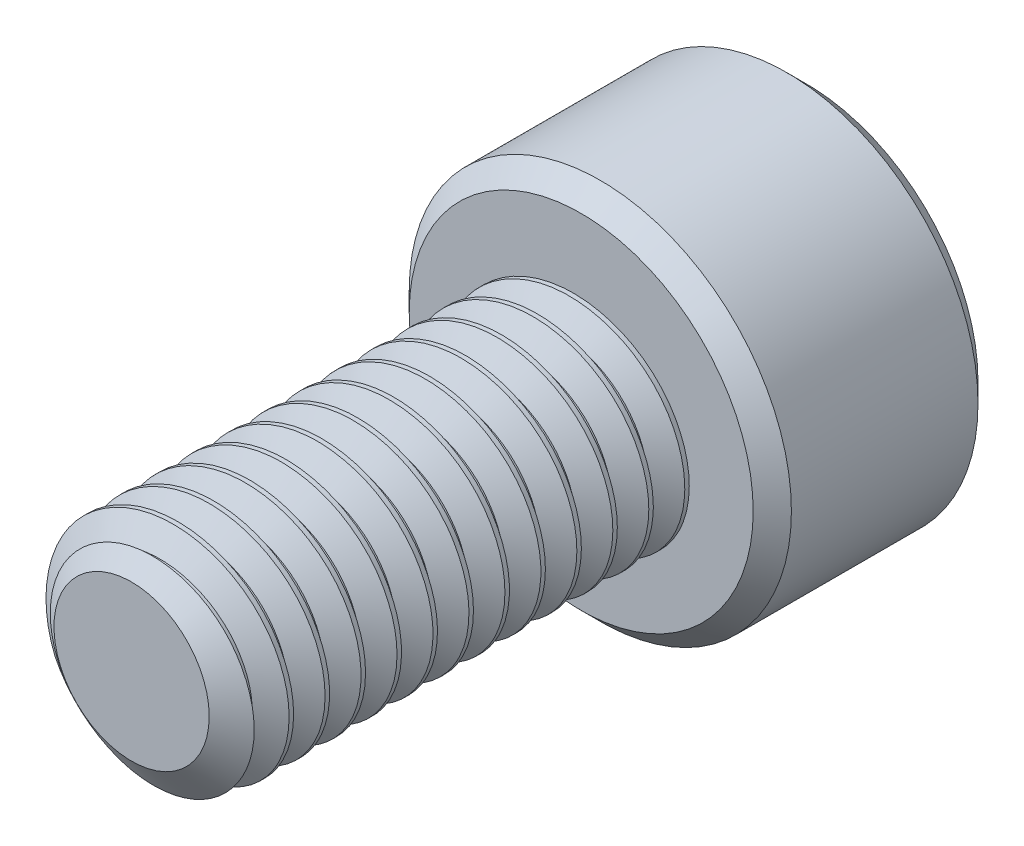
from build123d import *

# Parameters (mm, degrees)
SKETCH1_R          = 2.5
EXTRUDE1_DEPTH     = 10
CUT_SWEEP1_PITCH   = 0.8
SKETCH6_R          = 4.25
EXTRUDE2_DEPTH     = 5
CUT_EXTRUDE1_DEPTH = 3
CHAMFER1_SIZE      = 0.425


with BuildPart() as part:
    # Sketch1 → Extrude1 (new body)
    with BuildSketch(Plane.XY):
        Circle(SKETCH1_R)
    extrude(amount=-EXTRUDE1_DEPTH)

    # Cut-Sweep1: the profile of Sketch3 profile screwed along a right-hand helix of 13.5 turns, 6 arcs to a turn; built about Z, then put on its axis
    cut_sweep1_z = Axis((0, 0, 0), (0, 0, 1))
    cut_sweep1_corners = [(2.5003, 0, -0.700173205), (1.980384758, 0, -0.4), (1.980384758, 0, -0.3), (2.5003, 0, 0.000173205)]
    with BuildLine(mode=Mode.PRIVATE) as cut_sweep1_profile:
        Line(cut_sweep1_corners[0], cut_sweep1_corners[1])
        Line(cut_sweep1_corners[1], cut_sweep1_corners[2])
        Line(cut_sweep1_corners[2], cut_sweep1_corners[3])
        Line(cut_sweep1_corners[3], cut_sweep1_corners[0])
    cut_sweep1_cap = Face(cut_sweep1_profile.wire())
    cut_sweep1_turn_angles = [0, 30, 60, 90, 120, 150, 180, 210, 240, 270, 300, 330, 360]
    cut_sweep1_turn_weights = [1, 0.8660254037844387, 1, 0.8660254037844387, 1, 0.8660254037844387, 1, 0.8660254037844387, 1, 0.8660254037844387, 1, 0.8660254037844387, 1]
    cut_sweep1_turn_rails = [Edge.make_bspline([Vector(p[0], p[1], 0).rotate(cut_sweep1_z, cut_sweep1_turn_angles[k]) / cut_sweep1_turn_weights[k] + Vector(0, 0, p[2] + CUT_SWEEP1_PITCH * cut_sweep1_turn_angles[k] / 360) for k in range(13)], [0, 0, 0, 1, 1, 2, 2, 3, 3, 4, 4, 5, 5, 6, 6, 6], 2, cut_sweep1_turn_weights) for p in cut_sweep1_corners]
    cut_sweep1_turn_sides = [Face.make_surface_from_curves(cut_sweep1_turn_rails[p[0]], cut_sweep1_turn_rails[p[1]]) for p in [(0, 1), (1, 2), (2, 3), (3, 0)]]
    cut_sweep1_last_angles = [4680, 4710, 4740, 4770, 4800, 4830, 4860]
    cut_sweep1_last_weights = [1, 0.8660254037844387, 1, 0.8660254037844387, 1, 0.8660254037843435, 1]
    cut_sweep1_last_rails = [Edge.make_bspline([Vector(p[0], p[1], 0).rotate(cut_sweep1_z, cut_sweep1_last_angles[k]) / cut_sweep1_last_weights[k] + Vector(0, 0, p[2] + CUT_SWEEP1_PITCH * cut_sweep1_last_angles[k] / 360) for k in range(7)], [0, 0, 0, 1, 1, 2, 2, 3, 3, 3], 2, cut_sweep1_last_weights) for p in cut_sweep1_corners]
    cut_sweep1_last_sides = [Face.make_surface_from_curves(cut_sweep1_last_rails[p[0]], cut_sweep1_last_rails[p[1]]) for p in [(0, 1), (1, 2), (2, 3), (3, 0)]]
    cut_sweep1 = Plane(origin=(0, 0, 0), x_dir=(0, 1, 0), z_dir=(0, 0, -1)) * Solid(Shell([*[p.moved(Location((0, 0, CUT_SWEEP1_PITCH * i))) for i in range(13) for p in cut_sweep1_turn_sides], *cut_sweep1_last_sides, cut_sweep1_cap, cut_sweep1_cap.rotate(cut_sweep1_z, 4860).moved(Location((0, 0, CUT_SWEEP1_PITCH * 4860 / 360)))]))
    add(cut_sweep1, mode=Mode.SUBTRACT)

    # Sketch4 → Cut-Revolve1 (revolve, cut)
    with BuildSketch(Plane(origin=(0, 0, 0), x_dir=(0, 0, -1), z_dir=(1, 0, 0)), mode=Mode.PRIVATE) as cut_revolve1_sk:
        Polygon((0.541691224, 2.5), (0, 1.726384758), (0, 2.5), align=None)
    revolve(cut_revolve1_sk.sketch.rotate(Axis((0, 0, 0), (0, 0, -1)), 260.43858876), axis=Axis((0, 0, 0), (0, 0, -1)), mode=Mode.SUBTRACT)

    # Sketch6 → Extrude2 (add)
    with BuildSketch(Plane(origin=(0, 0, -10), x_dir=(-1, 0, 0), z_dir=(0, 0, -1))):
        Circle(SKETCH6_R)
    extrude(amount=EXTRUDE2_DEPTH)

    # Sketch7 → Cut-Extrude1 (cut)
    with BuildSketch(Plane(origin=(0, 0, -15), x_dir=(-1, 0, 0), z_dir=(0, 0, -1))):
        Polygon((0, 2.309401077), (-2, 1.154700538), (-2, -1.154700538), (0, -2.309401077), (2, -1.154700538), (2, 1.154700538), align=None)
    extrude(amount=-CUT_EXTRUDE1_DEPTH, mode=Mode.SUBTRACT)

    # Cut-Extrude2 cone 1 section (through the dimple's axis) → Cut-Extrude2 (revolve, cut)
    with BuildSketch(Plane(origin=(0, 0, -15), x_dir=(0, 1, 0), z_dir=(1, 0, 0))):
        Polygon((0, 0), (2.309401077, 0), (0, 2.309401077), align=None)
    revolve(axis=Axis((0, 0, -15), (0, 0, 1)), mode=Mode.SUBTRACT)

    # Chamfer1
    chamfer1_edges = [part.edges().sort_by_distance(p)[0] for p in [
        (4.25, 0, -10),
        (4.25, 0, -15),
    ]]
    chamfer(chamfer1_edges, length=CHAMFER1_SIZE)


solid = part.part
